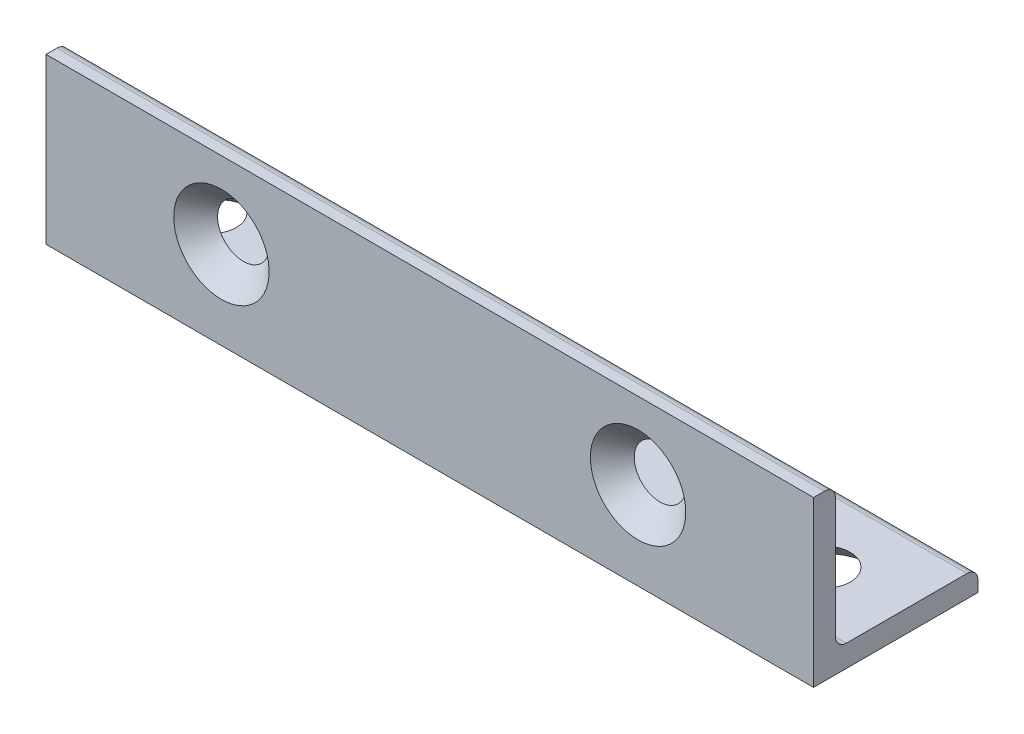
from build123d import *

# Parameters (mm, degrees)
EXTRUDE_1_DEPTH     = 70
SKETCH_2_R          = 2.3
CUT_EXTRUDE_1_DEPTH = 73.759879054
SKETCH_3_R          = 2.3
CUT_EXTRUDE_2_DEPTH = 73.759879054
CHAMFER_1_SIZE      = 2.05


with BuildPart() as part:
    # Эскиз1 → Бобышка-Вытянуть1 (new body)
    with BuildSketch(Plane(origin=(0, 0, 0), x_dir=(0, 0, -1), z_dir=(1, 0, 0))):
        with BuildLine():
            Line((0, 0), (0, 15))
            Line((0, 15), (1, 15))
            ThreePointArc((1, 15), (1.707106781, 14.707106781), (2, 14))
            Line((2, 14), (2, 3))
            ThreePointArc((2, 3), (2.292893219, 2.292893219), (3, 2))
            Line((3, 2), (14, 2))
            ThreePointArc((14, 2), (14.707106781, 1.707106781), (15, 1))
            Line((15, 1), (15, 0))
            Line((15, 0), (0, 0))
        make_face()
    extrude(amount=EXTRUDE_1_DEPTH)

    # Эскиз2 → Вырез-Вытянуть1 (cut, through all)
    with BuildSketch(Plane(origin=(0, 2, 0), x_dir=(1, 0, 0), z_dir=(0, 1, 0))):
        with Locations(Location((7, 8, 0), (0, 0, 270))):
            Circle(SKETCH_2_R)
        with Locations(Location((63, 8, 0), (0, 0, 270))):
            Circle(SKETCH_2_R)
    extrude(amount=-CUT_EXTRUDE_1_DEPTH, mode=Mode.SUBTRACT)

    # Эскиз3 → Вырез-Вытянуть2 (cut, through all)
    with BuildSketch(Plane(origin=(0, 0, -2), x_dir=(-1, 0, 0), z_dir=(0, 0, -1))):
        with Locations(Location((-16, 8, 0), (0, 0, 90))):
            Circle(SKETCH_3_R)
        with Locations(Location((-54, 8, 0), (0, 0, 90))):
            Circle(SKETCH_3_R)
    extrude(amount=-CUT_EXTRUDE_2_DEPTH, mode=Mode.SUBTRACT)

    # Фаска1
    # the kernel refuses this chamfer: 2.05 mm, written as the material it takes off along each edge
    with BuildSketch(Plane(origin=(63, 0, -8), x_dir=(0, 0, 1), z_dir=(-1, 0, 0))) as chamfer_1_piece_1:
        Polygon((2.3 + CHAMFER_1_SIZE, 0), (2.3, CHAMFER_1_SIZE), (2.3, 0), align=None)
    revolve(axis=Axis((63, 0, -8), (0, 1, 0)), mode=Mode.SUBTRACT)
    with BuildSketch(Plane(origin=(7, 0, -8), x_dir=(0, 0, 1), z_dir=(-1, 0, 0))) as chamfer_1_piece_2:
        Polygon((2.3 + CHAMFER_1_SIZE, 0), (2.3, CHAMFER_1_SIZE), (2.3, 0), align=None)
    revolve(axis=Axis((7, 0, -8), (0, 1, 0)), mode=Mode.SUBTRACT)
    with BuildSketch(Plane(origin=(54, 8, 0), x_dir=(0, 1, 0), z_dir=(-1, 0, 0))) as chamfer_1_piece_3:
        Polygon((2.3 + CHAMFER_1_SIZE, 0), (2.3, CHAMFER_1_SIZE), (2.3, 0), align=None)
    revolve(axis=Axis((54, 8, 0), (0, 0, -1)), mode=Mode.SUBTRACT)
    with BuildSketch(Plane(origin=(16, 8, 0), x_dir=(0, 1, 0), z_dir=(-1, 0, 0))) as chamfer_1_piece_4:
        Polygon((2.3 + CHAMFER_1_SIZE, 0), (2.3, CHAMFER_1_SIZE), (2.3, 0), align=None)
    revolve(axis=Axis((16, 8, 0), (0, 0, -1)), mode=Mode.SUBTRACT)


solid = part.part
